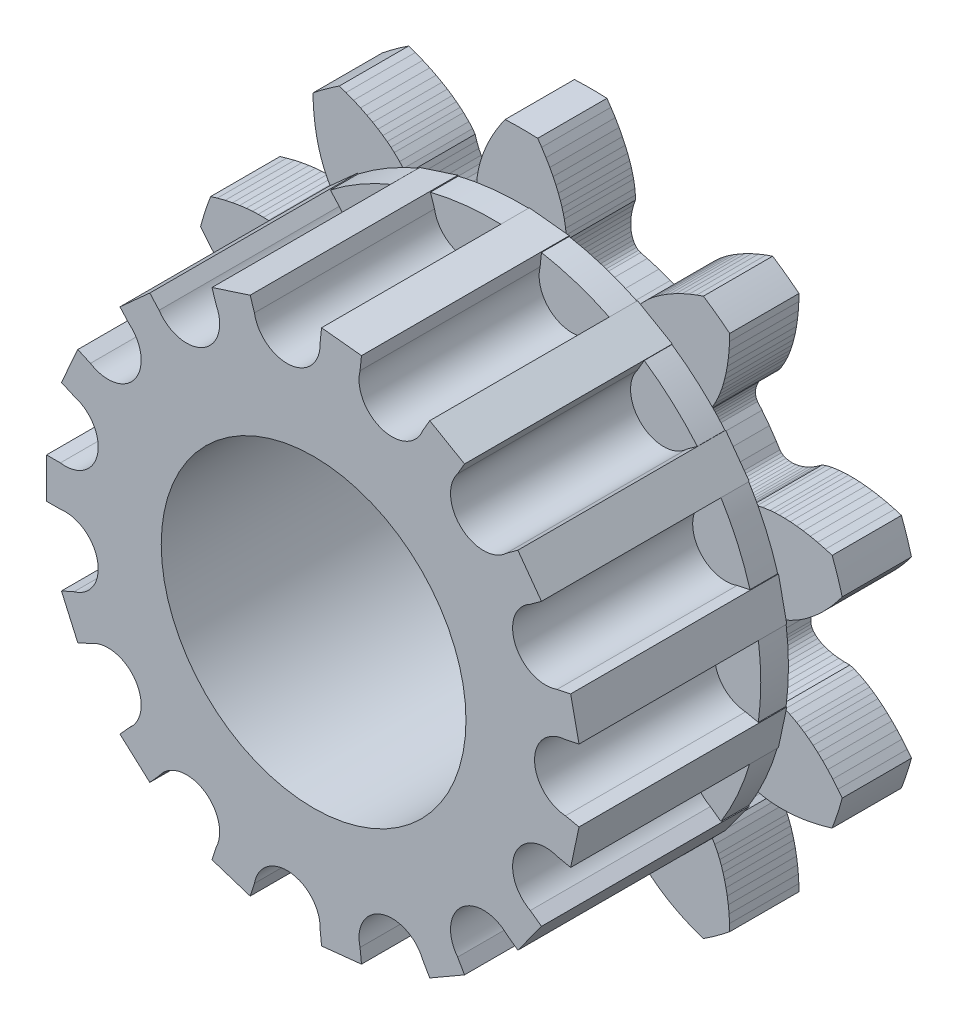
from build123d import *

# Parameters (mm, degrees)
MODEL_R             = 0.5
BOSS_EXTRUDE1_DEPTH = 5
SKETCH2_R           = 11
CUT_EXTRUDE1_DEPTH  = 87.698944957
BOSS_EXTRUDE2_DEPTH = 15
SKETCH4_R           = 11
CUT_EXTRUDE2_DEPTH  = 16
SKETCH7_R           = 19.280514364
SKETCH7_R_2         = 11
BOSS_EXTRUDE3_DEPTH = 2


with BuildPart() as part:
    # Model → Boss-Extrude1 (new body)
    with BuildSketch(Plane.XY):
        with BuildLine():
            Line((45.0072197, -17.6135177), (44.9713648, -18.1935982))
            Line((44.9713648, -18.1935982), (44.960078413, -18.702780784))
            ThreePointArc((44.960078413, -18.702780784), (45.893236682, -19.416293937), (46.860189796, -20.083292477))
            Line((46.860189796, -20.083292477), (47.3409636, -19.9152125))
            Line((47.3409636, -19.9152125), (47.8815731, -19.7018577))
            Line((47.8815731, -19.7018577), (48.3832652, -19.4791595))
            Line((48.3832652, -19.4791595), (48.8442917, -19.2509448))
            Line((48.8442917, -19.2509448), (49.2681476, -19.0185598))
            Line((49.2681476, -19.0185598), (49.652488, -18.7863735))
            Line((49.652488, -18.7863735), (49.999784, -18.5561983))
            Line((49.999784, -18.5561983), (50.3097144, -18.3315784))
            Line((50.3097144, -18.3315784), (50.584246, -18.1145512))
            Line((50.584246, -18.1145512), (50.8253064, -17.9070155))
            Line((50.8253064, -17.9070155), (51.2090617, -17.5331754))
            Line((51.2090617, -17.5331754), (51.4736068, -17.2287023))
            Line((51.4736068, -17.2287023), (51.6609452, -16.9687186))
            Line((51.6609452, -16.9687186), (51.7766666, -16.5968373))
            Line((51.7766666, -16.5968373), (51.926219, -16.211607))
            Line((51.926219, -16.211607), (52.09214, -15.8680652))
            Line((52.09214, -15.8680652), (52.2711992, -15.5668343))
            Line((52.2711992, -15.5668343), (52.4601462, -15.3083721))
            Line((52.4601462, -15.3083721), (52.655719, -15.092912))
            Line((52.655719, -15.092912), (52.8546606, -14.9204789))
            Line((52.8546606, -14.9204789), (53.053697, -14.7909236))
            Line((53.053697, -14.7909236), (53.2496281, -14.7039005))
            Line((53.2496281, -14.7039005), (53.4392401, -14.6588488))
            Line((53.4392401, -14.6588488), (53.6193745, -14.6550368))
            Line((53.6193745, -14.6550368), (53.7869408, -14.6915235))
            Line((53.7869408, -14.6915235), (54.2459233, -14.875985))
            Line((54.2459233, -14.875985), (55.0711789, -15.1693514))
            Line((55.0711789, -15.1693514), (55.9112613, -15.4170861))
            Line((55.9112613, -15.4170861), (56.3910096, -15.5376367))
            Line((56.3910096, -15.5376367), (56.5480199, -15.6066114))
            Line((56.5480199, -15.6066114), (56.6915111, -15.7155757))
            Line((56.6915111, -15.7155757), (56.8184297, -15.8634744))
            Line((56.8184297, -15.8634744), (56.9257904, -16.0490431))
            Line((56.9257904, -16.0490431), (57.0106635, -16.2708461))
            Line((57.0106635, -16.2708461), (57.070257, -16.5272824))
            Line((57.070257, -16.5272824), (57.1018345, -16.8165481))
            Line((57.1018345, -16.8165481), (57.1027755, -17.1367086))
            Line((57.1027755, -17.1367086), (57.0705784, -17.485658))
            Line((57.0705784, -17.485658), (57.0028826, -17.861115))
            Line((57.0028826, -17.861115), (56.8974402, -18.2606775))
            Line((56.8974402, -18.2606775), (56.7724745, -18.6295551))
            Line((56.7724745, -18.6295551), (56.7712199, -18.9500011))
            Line((56.7712199, -18.9500011), (56.8062766, -19.3518207))
            Line((56.8062766, -19.3518207), (56.8970034, -19.8798294))
            Line((56.8970034, -19.8798294), (56.9700389, -20.1894211))
            Line((56.9700389, -20.1894211), (57.0645743, -20.5263654))
            Line((57.0645743, -20.5263654), (57.183285, -20.8902593))
            Line((57.183285, -20.8902593), (57.3289597, -21.2806104))
            Line((57.3289597, -21.2806104), (57.503422, -21.6943627))
            Line((57.503422, -21.6943627), (57.7097362, -22.1315024))
            Line((57.7097362, -22.1315024), (57.9485732, -22.5871164))
            Line((57.9485732, -22.5871164), (58.2235519, -23.0621703))
            Line((58.2235519, -23.0621703), (58.5355074, -23.5525403))
            Line((58.5355074, -23.5525403), (58.82566651, -23.971111584))
            ThreePointArc((58.82566651, -23.971111584), (59.999999958, -23.9998592), (61.174333407, -23.971111588))
            Line((61.174333407, -23.971111588), (61.4644926, -23.5525403))
            Line((61.4644926, -23.5525403), (61.7764481, -23.0621703))
            Line((61.7764481, -23.0621703), (62.0514268, -22.5871164))
            Line((62.0514268, -22.5871164), (62.2902638, -22.1315024))
            Line((62.2902638, -22.1315024), (62.496578, -21.6943627))
            Line((62.496578, -21.6943627), (62.6710403, -21.2806104))
            Line((62.6710403, -21.2806104), (62.816715, -20.8902593))
            Line((62.816715, -20.8902593), (62.9354257, -20.5263654))
            Line((62.9354257, -20.5263654), (63.0299611, -20.1894211))
            Line((63.0299611, -20.1894211), (63.1029966, -19.8798294))
            Line((63.1029966, -19.8798294), (63.1937234, -19.3518207))
            Line((63.1937234, -19.3518207), (63.2287801, -18.9500011))
            Line((63.2287801, -18.9500011), (63.2275255, -18.6295551))
            Line((63.2275255, -18.6295551), (63.1025598, -18.2606775))
            Line((63.1025598, -18.2606775), (62.9971174, -17.861115))
            Line((62.9971174, -17.861115), (62.9294216, -17.485658))
            Line((62.9294216, -17.485658), (62.8972245, -17.1367086))
            Line((62.8972245, -17.1367086), (62.8981655, -16.8165481))
            Line((62.8981655, -16.8165481), (62.929743, -16.5272824))
            Line((62.929743, -16.5272824), (62.9893365, -16.2708461))
            Line((62.9893365, -16.2708461), (63.0742096, -16.0490431))
            Line((63.0742096, -16.0490431), (63.1815703, -15.8634744))
            Line((63.1815703, -15.8634744), (63.3084889, -15.7155757))
            Line((63.3084889, -15.7155757), (63.4519801, -15.6066114))
            Line((63.4519801, -15.6066114), (63.6089904, -15.5376367))
            Line((63.6089904, -15.5376367), (64.0887387, -15.4170861))
            Line((64.0887387, -15.4170861), (64.9288211, -15.1693514))
            Line((64.9288211, -15.1693514), (65.7540767, -14.875985))
            Line((65.7540767, -14.875985), (66.2130592, -14.6915235))
            Line((66.2130592, -14.6915235), (66.3806255, -14.6550368))
            Line((66.3806255, -14.6550368), (66.5607599, -14.6588488))
            Line((66.5607599, -14.6588488), (66.7503719, -14.7039005))
            Line((66.7503719, -14.7039005), (66.946303, -14.7909236))
            Line((66.946303, -14.7909236), (67.1453394, -14.9204789))
            Line((67.1453394, -14.9204789), (67.344281, -15.092912))
            Line((67.344281, -15.092912), (67.5398538, -15.3083721))
            Line((67.5398538, -15.3083721), (67.7288008, -15.5668343))
            Line((67.7288008, -15.5668343), (67.90786, -15.8680652))
            Line((67.90786, -15.8680652), (68.073781, -16.211607))
            Line((68.073781, -16.211607), (68.2233334, -16.5968373))
            Line((68.2233334, -16.5968373), (68.3390548, -16.9687186))
            Line((68.3390548, -16.9687186), (68.5263932, -17.2287023))
            Line((68.5263932, -17.2287023), (68.7909383, -17.5331754))
            Line((68.7909383, -17.5331754), (69.1746936, -17.9070155))
            Line((69.1746936, -17.9070155), (69.415754, -18.1145512))
            Line((69.415754, -18.1145512), (69.6902856, -18.3315784))
            Line((69.6902856, -18.3315784), (70.000216, -18.5561983))
            Line((70.000216, -18.5561983), (70.347512, -18.7863735))
            Line((70.347512, -18.7863735), (70.7318524, -19.0185598))
            Line((70.7318524, -19.0185598), (71.1557083, -19.2509448))
            Line((71.1557083, -19.2509448), (71.6167348, -19.4791595))
            Line((71.6167348, -19.4791595), (72.1184269, -19.7018577))
            Line((72.1184269, -19.7018577), (72.6590364, -19.9152125))
            Line((72.6590364, -19.9152125), (73.139810204, -20.083292477))
            ThreePointArc((73.139810204, -20.083292477), (74.106763318, -19.416293937), (75.039921587, -18.702780784))
            Line((75.039921587, -18.702780784), (75.0286352, -18.1935982))
            Line((75.0286352, -18.1935982), (74.9927803, -17.6135177))
            Line((74.9927803, -17.6135177), (74.9360131, -17.0675626))
            Line((74.9360131, -17.0675626), (74.8614331, -16.5585782))
            Line((74.8614331, -16.5585782), (74.7714004, -16.0836564))
            Line((74.7714004, -16.0836564), (74.6693459, -15.6463774))
            Line((74.6693459, -15.6463774), (74.5577566, -15.2449512))
            Line((74.5577566, -15.2449512), (74.4399041, -14.8807785))
            Line((74.4399041, -14.8807785), (74.318334, -14.5526184))
            Line((74.318334, -14.5526184), (74.1954475, -14.2592242))
            Line((74.1954475, -14.2592242), (73.9584913, -13.7787283))
            Line((73.9584913, -13.7787283), (73.7506692, -13.4330436))
            Line((73.7506692, -13.4330436), (73.5613007, -13.1745348))
            Line((73.5613007, -13.1745348), (73.2433805, -12.9495595))
            Line((73.2433805, -12.9495595), (72.9232189, -12.6882841))
            Line((72.9232189, -12.6882841), (72.6477637, -12.4243237))
            Line((72.6477637, -12.4243237), (72.4166084, -12.1609427))
            Line((72.4166084, -12.1609427), (72.2291841, -11.9013743))
            Line((72.2291841, -11.9013743), (72.0847047, -11.6487926))
            Line((72.0847047, -11.6487926), (71.9821874, -11.4063031))
            Line((71.9821874, -11.4063031), (71.9204786, -11.1769735))
            Line((71.9204786, -11.1769735), (71.8982608, -10.9637403))
            Line((71.8982608, -10.9637403), (71.9140074, -10.7694868))
            Line((71.9140074, -10.7694868), (71.9660466, -10.5969909))
            Line((71.9660466, -10.5969909), (72.0525282, -10.4489008))
            Line((72.0525282, -10.4489008), (72.369795, -10.0693844))
            Line((72.369795, -10.0693844), (72.9038211, -9.3751748))
            Line((72.9038211, -9.3751748), (73.3990305, -8.6527632))
            Line((73.3990305, -8.6527632), (73.6619313, -8.2337476))
            Line((73.6619313, -8.2337476), (73.776049, -8.1057363))
            Line((73.776049, -8.1057363), (73.9240214, -8.0029399))
            Line((73.9240214, -8.0029399), (74.1039014, -7.9279364))
            Line((74.1039014, -7.9279364), (74.313564, -7.8831741))
            Line((74.313564, -7.8831741), (74.5507384, -7.8709959))
            Line((74.5507384, -7.8709959), (74.8130393, -7.8935623))
            Line((74.8130393, -7.8935623), (75.0979052, -7.9529183))
            Line((75.0979052, -7.9529183), (75.4026868, -8.0509584))
            Line((75.4026868, -8.0509584), (75.7246079, -8.1894109))
            Line((75.7246079, -8.1894109), (76.0607696, -8.3698161))
            Line((76.0607696, -8.3698161), (76.4081926, -8.5935693))
            Line((76.4081926, -8.5935693), (76.7203996, -8.8264083))
            Line((76.7203996, -8.8264083), (77.0247741, -8.9266248))
            Line((77.0247741, -8.9266248), (77.4177604, -9.0174529))
            Line((77.4177604, -9.0174529), (77.9479626, -9.0943303))
            Line((77.9479626, -9.0943303), (78.2649711, -9.1205385))
            Line((78.2649711, -9.1205385), (78.6146371, -9.1347515))
            Line((78.6146371, -9.1347515), (78.9974044, -9.1343003))
            Line((78.9974044, -9.1343003), (79.4136663, -9.1163805))
            Line((79.4136663, -9.1163805), (79.86108, -9.0783135))
            Line((79.86108, -9.0783135), (80.3405791, -9.0171807))
            Line((80.3405791, -9.0171807), (80.8476985, -8.9308257))
            Line((80.8476985, -8.9308257), (81.3844747, -8.8161051))
            Line((81.3844747, -8.8161051), (81.9472438, -8.6709504))
            Line((81.9472438, -8.6709504), (82.434992789, -8.524338316))
            ThreePointArc((82.434992789, -8.524338316), (82.825222394, -7.416364364), (83.16077079, -6.290623409))
            Line((83.16077079, -6.290623409), (82.85235, -5.88532))
            Line((82.85235, -5.88532), (82.48238, -5.4371))
            Line((82.48238, -5.4371), (82.11555, -5.02878))
            Line((82.11555, -5.02878), (81.75604, -4.66084))
            Line((81.75604, -4.66084), (81.40405, -4.32954))
            Line((81.40405, -4.32954), (81.06446, -4.03576))
            Line((81.06446, -4.03576), (80.73823, -3.77659))
            Line((80.73823, -3.77659), (80.42883, -3.55124))
            Line((80.42883, -3.55124), (80.13759, -3.35721))
            Line((80.13759, -3.35721), (79.86572, -3.19208))
            Line((79.86572, -3.19208), (79.39159, -2.94263))
            Line((79.39159, -2.94263), (79.02027, -2.78512))
            Line((79.02027, -2.78512), (78.71512, -2.68729))
            Line((78.71512, -2.68729), (78.32568, -2.69215))
            Line((78.32568, -2.69215), (77.91309, -2.66896))
            Line((77.91309, -2.66896), (77.53509, -2.61732))
            Line((77.53509, -2.61732), (77.19327, -2.54011))
            Line((77.19327, -2.54011), (76.88907, -2.44028))
            Line((76.88907, -2.44028), (76.62372, -2.32086))
            Line((76.62372, -2.32086), (76.39825, -2.18494))
            Line((76.39825, -2.18494), (76.21353, -2.03568))
            Line((76.21353, -2.03568), (76.07022, -1.87623))
            Line((76.07022, -1.87623), (75.96878, -1.70982))
            Line((75.96878, -1.70982), (75.90949, -1.53968))
            Line((75.90949, -1.53968), (75.89241, -1.36904))
            Line((75.89241, -1.36904), (75.92601, -0.87552))
            Line((75.92601, -0.87552), (75.95, 0))
            Line((75.95, 0), (75.92601, 0.87552))
            Line((75.92601, 0.87552), (75.89241, 1.36904))
            Line((75.89241, 1.36904), (75.90949, 1.53968))
            Line((75.90949, 1.53968), (75.96878, 1.70982))
            Line((75.96878, 1.70982), (76.07022, 1.87623))
            Line((76.07022, 1.87623), (76.21353, 2.03568))
            Line((76.21353, 2.03568), (76.39825, 2.18494))
            Line((76.39825, 2.18494), (76.62372, 2.32086))
            Line((76.62372, 2.32086), (76.88907, 2.44028))
            Line((76.88907, 2.44028), (77.19327, 2.54011))
            Line((77.19327, 2.54011), (77.53509, 2.61732))
            Line((77.53509, 2.61732), (77.91309, 2.66896))
            Line((77.91309, 2.66896), (78.32568, 2.69215))
            Line((78.32568, 2.69215), (78.71512, 2.68729))
            Line((78.71512, 2.68729), (79.02027, 2.78512))
            Line((79.02027, 2.78512), (79.39159, 2.94263))
            Line((79.39159, 2.94263), (79.86572, 3.19208))
            Line((79.86572, 3.19208), (80.13759, 3.35721))
            Line((80.13759, 3.35721), (80.42883, 3.55124))
            Line((80.42883, 3.55124), (80.73823, 3.77659))
            Line((80.73823, 3.77659), (81.06446, 4.03576))
            Line((81.06446, 4.03576), (81.40405, 4.32954))
            Line((81.40405, 4.32954), (81.75604, 4.66084))
            Line((81.75604, 4.66084), (82.11555, 5.02878))
            Line((82.11555, 5.02878), (82.48238, 5.4371))
            Line((82.48238, 5.4371), (82.85235, 5.88532))
            Line((82.85235, 5.88532), (83.16077089, 6.290623409))
            ThreePointArc((83.16077089, 6.290623409), (82.825222494, 7.416364364), (82.434992889, 8.524338316))
            Line((82.434992889, 8.524338316), (81.9472438, 8.6709504))
            Line((81.9472438, 8.6709504), (81.3844747, 8.8161051))
            Line((81.3844747, 8.8161051), (80.8476985, 8.9308257))
            Line((80.8476985, 8.9308257), (80.3405791, 9.0171807))
            Line((80.3405791, 9.0171807), (79.86108, 9.0783135))
            Line((79.86108, 9.0783135), (79.4136663, 9.1163805))
            Line((79.4136663, 9.1163805), (78.9974044, 9.1343003))
            Line((78.9974044, 9.1343003), (78.6146371, 9.1347515))
            Line((78.6146371, 9.1347515), (78.2649711, 9.1205385))
            Line((78.2649711, 9.1205385), (77.9479626, 9.0943303))
            Line((77.9479626, 9.0943303), (77.4177604, 9.0174529))
            Line((77.4177604, 9.0174529), (77.0247741, 8.9266248))
            Line((77.0247741, 8.9266248), (76.7203996, 8.8264083))
            Line((76.7203996, 8.8264083), (76.4081926, 8.5935693))
            Line((76.4081926, 8.5935693), (76.0607696, 8.3698161))
            Line((76.0607696, 8.3698161), (75.7246079, 8.1894109))
            Line((75.7246079, 8.1894109), (75.4026868, 8.0509584))
            Line((75.4026868, 8.0509584), (75.0979052, 7.9529183))
            Line((75.0979052, 7.9529183), (74.8130393, 7.8935623))
            Line((74.8130393, 7.8935623), (74.5507384, 7.8709959))
            Line((74.5507384, 7.8709959), (74.313564, 7.8831741))
            Line((74.313564, 7.8831741), (74.1039014, 7.9279364))
            Line((74.1039014, 7.9279364), (73.9240214, 8.0029399))
            Line((73.9240214, 8.0029399), (73.776049, 8.1057363))
            Line((73.776049, 8.1057363), (73.6619313, 8.2337476))
            Line((73.6619313, 8.2337476), (73.3990305, 8.6527632))
            Line((73.3990305, 8.6527632), (72.9038211, 9.3751748))
            Line((72.9038211, 9.3751748), (72.369795, 10.0693844))
            Line((72.369795, 10.0693844), (72.0525282, 10.4489008))
            Line((72.0525282, 10.4489008), (71.9660466, 10.5969909))
            Line((71.9660466, 10.5969909), (71.9140074, 10.7694868))
            Line((71.9140074, 10.7694868), (71.8982608, 10.9637403))
            Line((71.8982608, 10.9637403), (71.9204786, 11.1769735))
            Line((71.9204786, 11.1769735), (71.9821874, 11.4063031))
            Line((71.9821874, 11.4063031), (72.0847047, 11.6487926))
            Line((72.0847047, 11.6487926), (72.2291841, 11.9013743))
            Line((72.2291841, 11.9013743), (72.4166084, 12.1609427))
            Line((72.4166084, 12.1609427), (72.6477637, 12.4243237))
            Line((72.6477637, 12.4243237), (72.9232189, 12.6882841))
            Line((72.9232189, 12.6882841), (73.2433805, 12.9495595))
            Line((73.2433805, 12.9495595), (73.5613007, 13.1745348))
            Line((73.5613007, 13.1745348), (73.7506692, 13.4330436))
            Line((73.7506692, 13.4330436), (73.9584913, 13.7787283))
            Line((73.9584913, 13.7787283), (74.1954475, 14.2592242))
            Line((74.1954475, 14.2592242), (74.318334, 14.5526184))
            Line((74.318334, 14.5526184), (74.4399041, 14.8807785))
            Line((74.4399041, 14.8807785), (74.5577566, 15.2449512))
            Line((74.5577566, 15.2449512), (74.6693459, 15.6463774))
            Line((74.6693459, 15.6463774), (74.7714004, 16.0836564))
            Line((74.7714004, 16.0836564), (74.8614331, 16.5585782))
            Line((74.8614331, 16.5585782), (74.9360131, 17.0675626))
            Line((74.9360131, 17.0675626), (74.9927803, 17.6135177))
            Line((74.9927803, 17.6135177), (75.0286352, 18.1935982))
            Line((75.0286352, 18.1935982), (75.039921587, 18.702780784))
            ThreePointArc((75.039921587, 18.702780784), (74.106763318, 19.416293937), (73.139810204, 20.083292477))
            Line((73.139810204, 20.083292477), (72.6590364, 19.9152125))
            Line((72.6590364, 19.9152125), (72.1184269, 19.7018577))
            Line((72.1184269, 19.7018577), (71.6167348, 19.4791595))
            Line((71.6167348, 19.4791595), (71.1557083, 19.2509448))
            Line((71.1557083, 19.2509448), (70.7318524, 19.0185598))
            Line((70.7318524, 19.0185598), (70.347512, 18.7863735))
            Line((70.347512, 18.7863735), (70.000216, 18.5561983))
            Line((70.000216, 18.5561983), (69.6902856, 18.3315784))
            Line((69.6902856, 18.3315784), (69.415754, 18.1145512))
            Line((69.415754, 18.1145512), (69.1746936, 17.9070155))
            Line((69.1746936, 17.9070155), (68.7909383, 17.5331754))
            Line((68.7909383, 17.5331754), (68.5263932, 17.2287023))
            Line((68.5263932, 17.2287023), (68.3390548, 16.9687186))
            Line((68.3390548, 16.9687186), (68.2233334, 16.5968373))
            Line((68.2233334, 16.5968373), (68.073781, 16.211607))
            Line((68.073781, 16.211607), (67.90786, 15.8680652))
            Line((67.90786, 15.8680652), (67.7288008, 15.5668343))
            Line((67.7288008, 15.5668343), (67.5398538, 15.3083721))
            Line((67.5398538, 15.3083721), (67.344281, 15.092912))
            Line((67.344281, 15.092912), (67.1453394, 14.9204789))
            Line((67.1453394, 14.9204789), (66.946303, 14.7909236))
            Line((66.946303, 14.7909236), (66.7503719, 14.7039005))
            Line((66.7503719, 14.7039005), (66.5607599, 14.6588488))
            Line((66.5607599, 14.6588488), (66.3806255, 14.6550368))
            Line((66.3806255, 14.6550368), (66.2130592, 14.6915235))
            Line((66.2130592, 14.6915235), (65.7540767, 14.875985))
            Line((65.7540767, 14.875985), (64.9288211, 15.1693514))
            Line((64.9288211, 15.1693514), (64.0887387, 15.4170861))
            Line((64.0887387, 15.4170861), (63.6089904, 15.5376367))
            Line((63.6089904, 15.5376367), (63.4519801, 15.6066114))
            Line((63.4519801, 15.6066114), (63.3084889, 15.7155757))
            Line((63.3084889, 15.7155757), (63.1815703, 15.8634744))
            Line((63.1815703, 15.8634744), (63.0742096, 16.0490431))
            Line((63.0742096, 16.0490431), (62.9893365, 16.2708461))
            Line((62.9893365, 16.2708461), (62.929743, 16.5272824))
            Line((62.929743, 16.5272824), (62.8981655, 16.8165481))
            Line((62.8981655, 16.8165481), (62.8972245, 17.1367086))
            Line((62.8972245, 17.1367086), (62.9294216, 17.485658))
            Line((62.9294216, 17.485658), (62.9971174, 17.861115))
            Line((62.9971174, 17.861115), (63.1025598, 18.2606775))
            Line((63.1025598, 18.2606775), (63.2275255, 18.6295551))
            Line((63.2275255, 18.6295551), (63.2287801, 18.9500011))
            Line((63.2287801, 18.9500011), (63.1937234, 19.3518207))
            Line((63.1937234, 19.3518207), (63.1029966, 19.8798294))
            Line((63.1029966, 19.8798294), (63.0299611, 20.1894211))
            Line((63.0299611, 20.1894211), (62.9354257, 20.5263654))
            Line((62.9354257, 20.5263654), (62.816715, 20.8902593))
            Line((62.816715, 20.8902593), (62.6710403, 21.2806104))
            Line((62.6710403, 21.2806104), (62.496578, 21.6943627))
            Line((62.496578, 21.6943627), (62.2902638, 22.1315024))
            Line((62.2902638, 22.1315024), (62.0514268, 22.5871164))
            Line((62.0514268, 22.5871164), (61.7764481, 23.0621703))
            Line((61.7764481, 23.0621703), (61.4644926, 23.5525403))
            Line((61.4644926, 23.5525403), (61.17433349, 23.971111584))
            ThreePointArc((61.17433349, 23.971111584), (60.000000042, 23.9998592), (58.825666593, 23.971111588))
            Line((58.825666593, 23.971111588), (58.5355074, 23.5525403))
            Line((58.5355074, 23.5525403), (58.2235519, 23.0621703))
            Line((58.2235519, 23.0621703), (57.9485732, 22.5871164))
            Line((57.9485732, 22.5871164), (57.7097362, 22.1315024))
            Line((57.7097362, 22.1315024), (57.503422, 21.6943627))
            Line((57.503422, 21.6943627), (57.3289597, 21.2806104))
            Line((57.3289597, 21.2806104), (57.183285, 20.8902593))
            Line((57.183285, 20.8902593), (57.0645743, 20.5263654))
            Line((57.0645743, 20.5263654), (56.9700389, 20.1894211))
            Line((56.9700389, 20.1894211), (56.8970034, 19.8798294))
            Line((56.8970034, 19.8798294), (56.8062766, 19.3518207))
            Line((56.8062766, 19.3518207), (56.7712199, 18.9500011))
            Line((56.7712199, 18.9500011), (56.7724745, 18.6295551))
            Line((56.7724745, 18.6295551), (56.8974402, 18.2606775))
            Line((56.8974402, 18.2606775), (57.0028826, 17.861115))
            Line((57.0028826, 17.861115), (57.0705784, 17.485658))
            Line((57.0705784, 17.485658), (57.1027755, 17.1367086))
            Line((57.1027755, 17.1367086), (57.1018345, 16.8165481))
            Line((57.1018345, 16.8165481), (57.070257, 16.5272824))
            Line((57.070257, 16.5272824), (57.0106635, 16.2708461))
            Line((57.0106635, 16.2708461), (56.9257904, 16.0490431))
            Line((56.9257904, 16.0490431), (56.8184297, 15.8634744))
            Line((56.8184297, 15.8634744), (56.6915111, 15.7155757))
            Line((56.6915111, 15.7155757), (56.5480199, 15.6066114))
            Line((56.5480199, 15.6066114), (56.3910096, 15.5376367))
            Line((56.3910096, 15.5376367), (55.9112613, 15.4170861))
            Line((55.9112613, 15.4170861), (55.0711789, 15.1693514))
            Line((55.0711789, 15.1693514), (54.2459233, 14.875985))
            Line((54.2459233, 14.875985), (53.7869408, 14.6915235))
            Line((53.7869408, 14.6915235), (53.6193745, 14.6550368))
            Line((53.6193745, 14.6550368), (53.4392401, 14.6588488))
            Line((53.4392401, 14.6588488), (53.2496281, 14.7039005))
            Line((53.2496281, 14.7039005), (53.053697, 14.7909236))
            Line((53.053697, 14.7909236), (52.8546606, 14.9204789))
            Line((52.8546606, 14.9204789), (52.655719, 15.092912))
            Line((52.655719, 15.092912), (52.4601462, 15.3083721))
            Line((52.4601462, 15.3083721), (52.2711992, 15.5668343))
            Line((52.2711992, 15.5668343), (52.09214, 15.8680652))
            Line((52.09214, 15.8680652), (51.926219, 16.211607))
            Line((51.926219, 16.211607), (51.7766666, 16.5968373))
            Line((51.7766666, 16.5968373), (51.6609452, 16.9687186))
            Line((51.6609452, 16.9687186), (51.4736068, 17.2287023))
            Line((51.4736068, 17.2287023), (51.2090617, 17.5331754))
            Line((51.2090617, 17.5331754), (50.8253064, 17.9070155))
            Line((50.8253064, 17.9070155), (50.584246, 18.1145512))
            Line((50.584246, 18.1145512), (50.3097144, 18.3315784))
            Line((50.3097144, 18.3315784), (49.999784, 18.5561983))
            Line((49.999784, 18.5561983), (49.652488, 18.7863735))
            Line((49.652488, 18.7863735), (49.2681476, 19.0185598))
            Line((49.2681476, 19.0185598), (48.8442917, 19.2509448))
            Line((48.8442917, 19.2509448), (48.3832652, 19.4791595))
            Line((48.3832652, 19.4791595), (47.8815731, 19.7018577))
            Line((47.8815731, 19.7018577), (47.3409636, 19.9152125))
            Line((47.3409636, 19.9152125), (46.860189796, 20.083292477))
            ThreePointArc((46.860189796, 20.083292477), (45.893236682, 19.416293937), (44.960078413, 18.702780784))
            Line((44.960078413, 18.702780784), (44.9713648, 18.1935982))
            Line((44.9713648, 18.1935982), (45.0072197, 17.6135177))
            Line((45.0072197, 17.6135177), (45.0639869, 17.0675626))
            Line((45.0639869, 17.0675626), (45.1385669, 16.5585782))
            Line((45.1385669, 16.5585782), (45.2285996, 16.0836564))
            Line((45.2285996, 16.0836564), (45.3306541, 15.6463774))
            Line((45.3306541, 15.6463774), (45.4422434, 15.2449512))
            Line((45.4422434, 15.2449512), (45.5600959, 14.8807785))
            Line((45.5600959, 14.8807785), (45.681666, 14.5526184))
            Line((45.681666, 14.5526184), (45.8045525, 14.2592242))
            Line((45.8045525, 14.2592242), (46.0415087, 13.7787283))
            Line((46.0415087, 13.7787283), (46.2493308, 13.4330436))
            Line((46.2493308, 13.4330436), (46.4386993, 13.1745348))
            Line((46.4386993, 13.1745348), (46.7566195, 12.9495595))
            Line((46.7566195, 12.9495595), (47.0767811, 12.6882841))
            Line((47.0767811, 12.6882841), (47.3522363, 12.4243237))
            Line((47.3522363, 12.4243237), (47.5833916, 12.1609427))
            Line((47.5833916, 12.1609427), (47.7708159, 11.9013743))
            Line((47.7708159, 11.9013743), (47.9152953, 11.6487926))
            Line((47.9152953, 11.6487926), (48.0178126, 11.4063031))
            Line((48.0178126, 11.4063031), (48.0795214, 11.1769735))
            Line((48.0795214, 11.1769735), (48.1017392, 10.9637403))
            Line((48.1017392, 10.9637403), (48.0859926, 10.7694868))
            Line((48.0859926, 10.7694868), (48.0339534, 10.5969909))
            Line((48.0339534, 10.5969909), (47.9474718, 10.4489008))
            Line((47.9474718, 10.4489008), (47.630205, 10.0693844))
            Line((47.630205, 10.0693844), (47.0961789, 9.3751748))
            Line((47.0961789, 9.3751748), (46.6009695, 8.6527632))
            Line((46.6009695, 8.6527632), (46.3380687, 8.2337476))
            Line((46.3380687, 8.2337476), (46.223951, 8.1057363))
            Line((46.223951, 8.1057363), (46.0759786, 8.0029399))
            Line((46.0759786, 8.0029399), (45.8960986, 7.9279364))
            Line((45.8960986, 7.9279364), (45.686436, 7.8831741))
            Line((45.686436, 7.8831741), (45.4492616, 7.8709959))
            Line((45.4492616, 7.8709959), (45.1869607, 7.8935623))
            Line((45.1869607, 7.8935623), (44.9020948, 7.9529183))
            Line((44.9020948, 7.9529183), (44.5973132, 8.0509584))
            Line((44.5973132, 8.0509584), (44.2753921, 8.1894109))
            Line((44.2753921, 8.1894109), (43.9392304, 8.3698161))
            Line((43.9392304, 8.3698161), (43.5918074, 8.5935693))
            Line((43.5918074, 8.5935693), (43.2796004, 8.8264083))
            Line((43.2796004, 8.8264083), (42.9752259, 8.9266248))
            Line((42.9752259, 8.9266248), (42.5822396, 9.0174529))
            Line((42.5822396, 9.0174529), (42.0520374, 9.0943303))
            Line((42.0520374, 9.0943303), (41.7350289, 9.1205385))
            Line((41.7350289, 9.1205385), (41.3853629, 9.1347515))
            Line((41.3853629, 9.1347515), (41.0025956, 9.1343003))
            Line((41.0025956, 9.1343003), (40.5863337, 9.1163805))
            Line((40.5863337, 9.1163805), (40.13892, 9.0783135))
            Line((40.13892, 9.0783135), (39.6594209, 9.0171807))
            Line((39.6594209, 9.0171807), (39.1523015, 8.9308257))
            Line((39.1523015, 8.9308257), (38.6155253, 8.8161051))
            Line((38.6155253, 8.8161051), (38.0527562, 8.6709504))
            Line((38.0527562, 8.6709504), (37.565007211, 8.524338316))
            ThreePointArc((37.565007211, 8.524338316), (37.174777606, 7.416364364), (36.83922921, 6.290623409))
            Line((36.83922921, 6.290623409), (37.14765, 5.88532))
            Line((37.14765, 5.88532), (37.51762, 5.4371))
            Line((37.51762, 5.4371), (37.88445, 5.02878))
            Line((37.88445, 5.02878), (38.24396, 4.66084))
            Line((38.24396, 4.66084), (38.59595, 4.32954))
            Line((38.59595, 4.32954), (38.93554, 4.03576))
            Line((38.93554, 4.03576), (39.26177, 3.77659))
            Line((39.26177, 3.77659), (39.57117, 3.55124))
            Line((39.57117, 3.55124), (39.86241, 3.35721))
            Line((39.86241, 3.35721), (40.13428, 3.19208))
            Line((40.13428, 3.19208), (40.60841, 2.94263))
            Line((40.60841, 2.94263), (40.97973, 2.78512))
            Line((40.97973, 2.78512), (41.28488, 2.68729))
            Line((41.28488, 2.68729), (41.67432, 2.69215))
            Line((41.67432, 2.69215), (42.08691, 2.66896))
            Line((42.08691, 2.66896), (42.46491, 2.61732))
            Line((42.46491, 2.61732), (42.80673, 2.54011))
            Line((42.80673, 2.54011), (43.11093, 2.44028))
            Line((43.11093, 2.44028), (43.37628, 2.32086))
            Line((43.37628, 2.32086), (43.60175, 2.18494))
            Line((43.60175, 2.18494), (43.78647, 2.03568))
            Line((43.78647, 2.03568), (43.92978, 1.87623))
            Line((43.92978, 1.87623), (44.03122, 1.70982))
            Line((44.03122, 1.70982), (44.09051, 1.53968))
            Line((44.09051, 1.53968), (44.10759, 1.36904))
            Line((44.10759, 1.36904), (44.07399, 0.87552))
            Line((44.07399, 0.87552), (44.05, 0))
            Line((44.05, 0), (44.07399, -0.87552))
            Line((44.07399, -0.87552), (44.10759, -1.36904))
            Line((44.10759, -1.36904), (44.09051, -1.53968))
            Line((44.09051, -1.53968), (44.03122, -1.70982))
            Line((44.03122, -1.70982), (43.92978, -1.87623))
            Line((43.92978, -1.87623), (43.78647, -2.03568))
            Line((43.78647, -2.03568), (43.60175, -2.18494))
            Line((43.60175, -2.18494), (43.37628, -2.32086))
            Line((43.37628, -2.32086), (43.11093, -2.44028))
            Line((43.11093, -2.44028), (42.80673, -2.54011))
            Line((42.80673, -2.54011), (42.46491, -2.61732))
            Line((42.46491, -2.61732), (42.08691, -2.66896))
            Line((42.08691, -2.66896), (41.67432, -2.69215))
            Line((41.67432, -2.69215), (41.28488, -2.68729))
            Line((41.28488, -2.68729), (40.97973, -2.78512))
            Line((40.97973, -2.78512), (40.60841, -2.94263))
            Line((40.60841, -2.94263), (40.13428, -3.19208))
            Line((40.13428, -3.19208), (39.86241, -3.35721))
            Line((39.86241, -3.35721), (39.57117, -3.55124))
            Line((39.57117, -3.55124), (39.26177, -3.77659))
            Line((39.26177, -3.77659), (38.93554, -4.03576))
            Line((38.93554, -4.03576), (38.59595, -4.32954))
            Line((38.59595, -4.32954), (38.24396, -4.66084))
            Line((38.24396, -4.66084), (37.88445, -5.02878))
            Line((37.88445, -5.02878), (37.51762, -5.4371))
            Line((37.51762, -5.4371), (37.14765, -5.88532))
            Line((37.14765, -5.88532), (36.83922911, -6.290623409))
            ThreePointArc((36.83922911, -6.290623409), (37.174777506, -7.416364364), (37.565007111, -8.524338316))
            Line((37.565007111, -8.524338316), (38.0527562, -8.6709504))
            Line((38.0527562, -8.6709504), (38.6155253, -8.8161051))
            Line((38.6155253, -8.8161051), (39.1523015, -8.9308257))
            Line((39.1523015, -8.9308257), (39.6594209, -9.0171807))
            Line((39.6594209, -9.0171807), (40.13892, -9.0783135))
            Line((40.13892, -9.0783135), (40.5863337, -9.1163805))
            Line((40.5863337, -9.1163805), (41.0025956, -9.1343003))
            Line((41.0025956, -9.1343003), (41.3853629, -9.1347515))
            Line((41.3853629, -9.1347515), (41.7350289, -9.1205385))
            Line((41.7350289, -9.1205385), (42.0520374, -9.0943303))
            Line((42.0520374, -9.0943303), (42.5822396, -9.0174529))
            Line((42.5822396, -9.0174529), (42.9752259, -8.9266248))
            Line((42.9752259, -8.9266248), (43.2796004, -8.8264083))
            Line((43.2796004, -8.8264083), (43.5918074, -8.5935693))
            Line((43.5918074, -8.5935693), (43.9392304, -8.3698161))
            Line((43.9392304, -8.3698161), (44.2753921, -8.1894109))
            Line((44.2753921, -8.1894109), (44.5973132, -8.0509584))
            Line((44.5973132, -8.0509584), (44.9020948, -7.9529183))
            Line((44.9020948, -7.9529183), (45.1869607, -7.8935623))
            Line((45.1869607, -7.8935623), (45.4492616, -7.8709959))
            Line((45.4492616, -7.8709959), (45.686436, -7.8831741))
            Line((45.686436, -7.8831741), (45.8960986, -7.9279364))
            Line((45.8960986, -7.9279364), (46.0759786, -8.0029399))
            Line((46.0759786, -8.0029399), (46.223951, -8.1057363))
            Line((46.223951, -8.1057363), (46.3380687, -8.2337476))
            Line((46.3380687, -8.2337476), (46.6009695, -8.6527632))
            Line((46.6009695, -8.6527632), (47.0961789, -9.3751748))
            Line((47.0961789, -9.3751748), (47.630205, -10.0693844))
            Line((47.630205, -10.0693844), (47.9474718, -10.4489008))
            Line((47.9474718, -10.4489008), (48.0339534, -10.5969909))
            Line((48.0339534, -10.5969909), (48.0859926, -10.7694868))
            Line((48.0859926, -10.7694868), (48.1017392, -10.9637403))
            Line((48.1017392, -10.9637403), (48.0795214, -11.1769735))
            Line((48.0795214, -11.1769735), (48.0178126, -11.4063031))
            Line((48.0178126, -11.4063031), (47.9152953, -11.6487926))
            Line((47.9152953, -11.6487926), (47.7708159, -11.9013743))
            Line((47.7708159, -11.9013743), (47.5833916, -12.1609427))
            Line((47.5833916, -12.1609427), (47.3522363, -12.4243237))
            Line((47.3522363, -12.4243237), (47.0767811, -12.6882841))
            Line((47.0767811, -12.6882841), (46.7566195, -12.9495595))
            Line((46.7566195, -12.9495595), (46.4386993, -13.1745348))
            Line((46.4386993, -13.1745348), (46.2493308, -13.4330436))
            Line((46.2493308, -13.4330436), (46.0415087, -13.7787283))
            Line((46.0415087, -13.7787283), (45.8045525, -14.2592242))
            Line((45.8045525, -14.2592242), (45.681666, -14.5526184))
            Line((45.681666, -14.5526184), (45.5600959, -14.8807785))
            Line((45.5600959, -14.8807785), (45.4422434, -15.2449512))
            Line((45.4422434, -15.2449512), (45.3306541, -15.6463774))
            Line((45.3306541, -15.6463774), (45.2285996, -16.0836564))
            Line((45.2285996, -16.0836564), (45.1385669, -16.5585782))
            Line((45.1385669, -16.5585782), (45.0639869, -17.0675626))
            Line((45.0639869, -17.0675626), (45.0072197, -17.6135177))
        make_face()
        with Locations((60, 0)):
            Circle(MODEL_R, mode=Mode.SUBTRACT)
    extrude(amount=BOSS_EXTRUDE1_DEPTH)

    # Sketch2 → Cut-Extrude1 (cut, through all)
    with BuildSketch(Plane(origin=(0, 0, 0), x_dir=(-1, 0, 0), z_dir=(0, 0, -1))):
        with Locations((-60, 0)):
            Circle(SKETCH2_R)
    extrude(amount=-CUT_EXTRUDE1_DEPTH, mode=Mode.SUBTRACT)

    # Sketch3 → Boss-Extrude2 (add)
    with BuildSketch(Plane.XY.offset(5)):
        with BuildLine():
            Line((68.384885374, 17.422204489), (67.884885374, 16.556179085))
            ThreePointArc((67.884885375, 16.556179085), (64.928821096, 15.169351401), (63.352471745, 18.028849569))
            Line((63.352471745, 18.028849569), (63.457000208, 19.023371465))
            Line((63.457000208, 19.023371465), (60.573724978, 19.326415903))
            Line((60.573724978, 19.326415903), (60.469196514, 18.331894007))
            ThreePointArc((60.469196516, 18.331894007), (60.470598061, 18.284676523), (60.471065304, 18.237440554))
            ThreePointArc((60.471065304, 18.237440554), (58.285745011, 15.858151395), (55.729641582, 17.833746734))
            Line((55.729641582, 17.833746734), (55.420624588, 18.78480325))
            Line((55.420624588, 18.78480325), (52.66336232, 17.888914432))
            Line((52.66336232, 17.888914432), (52.972379315, 16.937857916))
            ThreePointArc((52.972379316, 16.937857916), (53.156489572, 16.423663498), (53.218948804, 15.881085088))
            ThreePointArc((53.218948804, 15.881085088), (51.523883745, 13.595907274), (48.845195185, 14.555027074))
            Line((48.845195185, 14.555027074), (48.176064578, 15.298171899))
            Line((48.176064578, 15.298171899), (46.021570969, 13.35825714))
            Line((46.021570969, 13.35825714), (46.690701576, 12.615112315))
            ThreePointArc((46.690701576, 12.615112316), (47.326142797, 11.792953305), (47.552226829, 10.778745736))
            ThreePointArc((47.552226829, 10.778745736), (46.317136903, 8.687552501), (43.889515878, 8.759611004))
            Line((43.889515878, 8.759611004), (42.975970421, 9.166347647))
            Line((42.975970421, 9.166347647), (41.796776987, 6.517835833))
            Line((41.796776987, 6.517835833), (42.710322445, 6.11109919))
            ThreePointArc((42.710322445, 6.111099191), (43.966536636, 5.254174316), (44.45072709, 3.812663323))
            ThreePointArc((44.45072709, 3.812663323), (43.625229074, 2.006849848), (41.719485636, 1.449578614))
            Line((41.719485636, 1.449578614), (40.719485636, 1.449578614))
            Line((40.719485636, 1.449578614), (40.719485636, -1.449578502))
            Line((40.719485636, -1.449578502), (41.719485636, -1.449578502))
            ThreePointArc((41.719485635, -1.449578501), (43.625229059, -2.006849747), (44.450727067, -3.812663214))
            ThreePointArc((44.450727067, -3.812663214), (43.966536606, -5.254174216), (42.7103224, -6.111099088))
            Line((42.7103224, -6.111099088), (41.796776942, -6.517835731))
            Line((41.796776942, -6.517835731), (42.975970375, -9.166347546))
            Line((42.975970375, -9.166347546), (43.889515833, -8.759610903))
            ThreePointArc((43.889515832, -8.759610902), (46.317136848, -8.687552417), (47.552226764, -10.778745645))
            ThreePointArc((47.552226764, -10.778745645), (47.326142727, -11.792953225), (46.690701493, -12.61511224))
            Line((46.690701493, -12.61511224), (46.021570886, -13.358257066))
            Line((46.021570886, -13.358257066), (48.176064496, -15.298171825))
            Line((48.176064496, -15.298171825), (48.845195102, -14.555026999))
            ThreePointArc((48.845195101, -14.555026999), (51.52388366, -13.595907221), (53.218948707, -15.881085032))
            ThreePointArc((53.218948707, -15.881085032), (53.156489473, -16.423663453), (52.972379209, -16.937857881))
            Line((52.972379209, -16.937857881), (52.663362215, -17.888914397))
            Line((52.663362215, -17.888914397), (55.420624482, -18.784803216))
            Line((55.420624482, -18.784803216), (55.729641476, -17.833746699))
            ThreePointArc((55.729641475, -17.833746699), (58.285744912, -15.858151384), (60.471065192, -18.237440542))
            ThreePointArc((60.471065192, -18.237440542), (60.47059795, -18.284676523), (60.469196404, -18.331894019))
            Line((60.469196404, -18.331894019), (60.573724867, -19.326415914))
            Line((60.573724867, -19.326415914), (63.457000097, -19.023371476))
            Line((63.457000097, -19.023371476), (63.352471634, -18.028849581))
            ThreePointArc((63.352471633, -18.028849581), (64.928821012, -15.169351429), (67.884885278, -16.556179141))
            Line((67.884885278, -16.556179141), (68.384885278, -17.422204545))
            Line((68.384885278, -17.422204545), (70.89562899, -15.972625986))
            Line((70.89562899, -15.972625986), (70.39562899, -15.106600583))
            ThreePointArc((70.395628989, -15.106600583), (70.672633125, -11.85315998), (73.937205856, -11.917750481))
            Line((73.937205856, -11.917750481), (74.74622285, -12.505535733))
            Line((74.74622285, -12.505535733), (76.450304647, -10.160068357))
            Line((76.450304647, -10.160068357), (75.641287653, -9.572283105))
            ThreePointArc((75.641287652, -9.572283106), (74.571050012, -6.487449489), (77.579656925, -5.218634494))
            Line((77.579656925, -5.218634494), (78.557804526, -5.426546185))
            Line((78.557804526, -5.426546185), (79.160573184, -2.590742607))
            Line((79.160573184, -2.590742607), (78.182425583, -2.382830916))
            ThreePointArc((78.182425583, -2.382830918), (75.949999979, -4.4e-08), (78.182425606, 2.382830807))
            Line((78.182425606, 2.382830807), (79.160573207, 2.590742498))
            Line((79.160573207, 2.590742498), (78.557804549, 5.426546076))
            Line((78.557804549, 5.426546076), (77.579656948, 5.218634385))
            ThreePointArc((77.579656949, 5.218634384), (74.571050048, 6.487449408), (75.641287718, 9.572283015))
            Line((75.641287718, 9.572283015), (76.450304712, 10.160068267))
            Line((76.450304712, 10.160068267), (74.746222915, 12.505535643))
            Line((74.746222915, 12.505535643), (73.937205921, 11.917750391))
            ThreePointArc((73.937205922, 11.91775039), (70.67263319, 11.853159921), (70.395629087, 15.106600527))
            Line((70.395629087, 15.106600527), (70.895629087, 15.972625931))
            Line((70.895629087, 15.972625931), (68.384885374, 17.422204489))
        make_face()
    extrude(amount=BOSS_EXTRUDE2_DEPTH)

    # Sketch4 → Cut-Extrude2 (cut)
    with BuildSketch(Plane(origin=(0, 0, 5), x_dir=(-1, 0, 0), z_dir=(0, 0, -1))):
        with Locations((-60, 0)):
            Circle(SKETCH4_R)
    extrude(amount=-CUT_EXTRUDE2_DEPTH, mode=Mode.SUBTRACT)

    # Sketch7 → Boss-Extrude3 (add)
    with BuildSketch(Plane.XY.offset(5)):
        with Locations((60, 0)):
            Circle(SKETCH7_R)
        with Locations((60, 0)):
            Circle(SKETCH7_R_2, mode=Mode.SUBTRACT)
    extrude(amount=BOSS_EXTRUDE3_DEPTH)


solid = part.part
